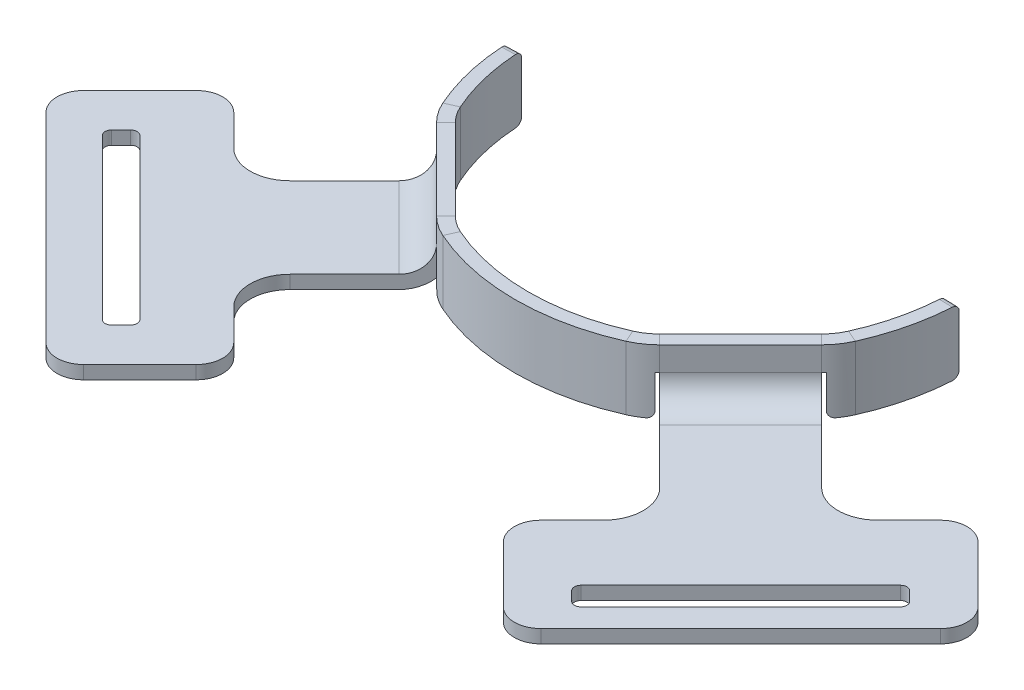
from build123d import *

# Parameters (mm, degrees)
BASE_FLANGE1_DEPTH             = 7.62
EDGE_FLANGE1_STRIP_W           = 12.7
EDGE_FLANGE1_STRIP_H           = 1.5875
EDGE_FLANGE1_STRIP_CUT_DEPTH   = 13.689174868
EDGE_FLANGE1_STRIP_2_W         = 12.7
EDGE_FLANGE1_STRIP_2_H         = 1.5875
EDGE_FLANGE1_STRIP_CUT_2_DEPTH = 13.689174868
EDGE_FLANGE1_DEPTH             = 13.689174868
EDGE_FLANGE1_BEND_DEPTH        = 13.689174868
SKETCH12_W                     = 0.396875
SKETCH12_H                     = 4.784490506
SKETCH12_H_2                   = 4.782978668
CUT_EXTRUDE3_DEPTH             = 25.4
SKETCH13_W                     = 0.396875
SKETCH13_H                     = 4.7625
CUT_EXTRUDE4_DEPTH             = 25.4
FILLET2_R                      = 0.79375
BOSS_EXTRUDE1_DEPTH            = 1.5875
FILLET3_R                      = 3.175
FILLET4_R                      = 4.7625
FILLET5_R                      = 0.79375


# Read off the part's stored shape, not the designer's step: Base-Flange1
# Sheet-metal steps are written as plain solids
with BuildPart() as part:
    # Base-Flange1 outline → Base-Flange1 (new body)
    with BuildSketch(Plane(origin=(0, 0, 0), x_dir=(1, 0, 0), z_dir=(0, 1, 0))):
        with BuildLine():
            ThreePointArc((24.665208878, -10.952288676), (26.30984284, -6.00976921), (26.974319291, -0.843359375))
            Line((26.974319291, -0.843359375), (25.387594627, -0.79375))
            ThreePointArc((25.387594627, -0.79375), (24.762205026, -5.656253374), (23.214314238, -10.308036401))
            ThreePointArc((23.214314238, -10.308036401), (22.645724221, -11.325105064), (21.900863739, -12.221155361))
            Line((21.900863739, -12.221155361), (12.221155361, -21.900863739))
            ThreePointArc((12.221155361, -21.900863739), (11.325105064, -22.645724221), (10.308036401, -23.214314238))
            ThreePointArc((10.308036401, -23.214314238), (0, -25.4), (-10.308036401, -23.214314238))
            ThreePointArc((-10.308036401, -23.214314238), (-11.325105064, -22.645724221), (-12.221155361, -21.900863739))
            Line((-12.221155361, -21.900863739), (-21.900863739, -12.221155361))
            ThreePointArc((-21.900863739, -12.221155361), (-22.645724221, -11.325105064), (-23.214314238, -10.308036401))
            ThreePointArc((-23.214314238, -10.308036401), (-24.762205026, -5.656253374), (-25.387594627, -0.79375))
            Line((-25.387594627, -0.79375), (-26.974319291, -0.843359375))
            ThreePointArc((-26.974319291, -0.843359375), (-26.30984284, -6.00976921), (-24.665208878, -10.952288676))
            ThreePointArc((-24.665208878, -10.952288676), (-23.954471356, -12.223624504), (-23.023395754, -13.343687376))
            Line((-23.023395754, -13.343687376), (-13.343687376, -23.023395754))
            ThreePointArc((-13.343687376, -23.023395754), (-12.223624504, -23.954471356), (-10.952288676, -24.665208878))
            ThreePointArc((-10.952288676, -24.665208878), (0, -26.9875), (10.952288676, -24.665208878))
            ThreePointArc((10.952288676, -24.665208878), (12.223624504, -23.954471356), (13.343687376, -23.023395754))
            Line((13.343687376, -23.023395754), (23.023395754, -13.343687376))
            ThreePointArc((23.023395754, -13.343687376), (23.954471356, -12.223624504), (24.665208878, -10.952288676))
        make_face()
    extrude(amount=BASE_FLANGE1_DEPTH)

    # Edge-Flange1 strip (across the edge) → Edge-Flange1 strip cut (cut)
    with BuildSketch(Plane(origin=(-23.023395754, 0, 13.343687376), x_dir=(0, 1, 0), z_dir=(0.7071067811865437, 0, 0.7071067811865515))):
        with Locations((-1.5875, -0.79375)):
            Rectangle(EDGE_FLANGE1_STRIP_W, EDGE_FLANGE1_STRIP_H)
    extrude(amount=EDGE_FLANGE1_STRIP_CUT_DEPTH, mode=Mode.SUBTRACT)

    # Edge-Flange1 strip 2 (across the edge) → Edge-Flange1 strip cut 2 (cut)
    with BuildSketch(Plane(origin=(13.343687376, 0, 23.023395754), x_dir=(0, 1, 0), z_dir=(0.7071067811865512, 0, -0.7071067811865438))):
        with Locations((-1.5875, -0.79375)):
            Rectangle(EDGE_FLANGE1_STRIP_2_W, EDGE_FLANGE1_STRIP_2_H)
    extrude(amount=EDGE_FLANGE1_STRIP_CUT_2_DEPTH, mode=Mode.SUBTRACT)

    # Edge-Flange1 section (across the edge) → Edge-Flange1 (add)
    with BuildSketch(Plane(origin=(-23.023395754, 0, 13.343687376), x_dir=(0, 1, 0), z_dir=(0.7071067811865437, 0, 0.7071067811865515))):
        with BuildLine():
            Line((0, 3.175), (0, 7.9375))
            Line((0, 7.9375), (1.5875, 7.9375))
            Line((1.5875, 7.9375), (1.5875, 3.175))
            ThreePointArc((1.5875, 3.175), (2.51743597, 0.92993597), (4.7625, 0))
            Line((4.7625, 0), (4.7625, -1.5875))
            ThreePointArc((4.7625, -1.5875), (1.394903955, -0.192596045), (0, 3.175))
        make_face()
    extrude(amount=EDGE_FLANGE1_DEPTH)

    # Edge-Flange1 section 2 (across the edge) → Edge-Flange1 bend (add)
    with BuildSketch(Plane(origin=(13.343687376, 0, 23.023395754), x_dir=(0, 1, 0), z_dir=(0.7071067811865512, 0, -0.7071067811865438))):
        with BuildLine():
            Line((0, 3.175), (0, 7.9375))
            Line((0, 7.9375), (1.5875, 7.9375))
            Line((1.5875, 7.9375), (1.5875, 3.175))
            ThreePointArc((1.5875, 3.175), (2.51743597, 0.92993597), (4.7625, 0))
            Line((4.7625, 0), (4.7625, -1.5875))
            ThreePointArc((4.7625, -1.5875), (1.394903955, -0.192596045), (0, 3.175))
        make_face()
    extrude(amount=EDGE_FLANGE1_BEND_DEPTH)

    # Sketch12 → Cut-Extrude3 (cut)
    with BuildSketch(Plane(origin=(-23.796201641, 0, 23.796201641), x_dir=(0.7071067811865438, 3.532708032038459e-15, 0.7071067811865512), z_dir=(-0.7071067811865512, -3.532708032038497e-15, 0.7071067811865438))):
        with Locations((7.043024934, 2.370254747)):
            Rectangle(SKETCH12_W, SKETCH12_H)
        with Locations((-7.043024934, 2.371010666)):
            Rectangle(SKETCH12_W, SKETCH12_H_2)
    extrude(amount=-CUT_EXTRUDE3_DEPTH, mode=Mode.SUBTRACT)

    # Sketch13 → Cut-Extrude4 (cut)
    with BuildSketch(Plane(origin=(23.796201641, 0, 23.796201641), x_dir=(0.7071067811865513, 3.414951097637176e-15, -0.7071067811865437), z_dir=(0.7071067811865437, -3.414951097637212e-15, 0.7071067811865513))):
        with Locations((7.043024934, 2.38125)):
            Rectangle(SKETCH13_W, SKETCH13_H)
        with Locations((-7.043024934, 2.38125)):
            Rectangle(SKETCH13_W, SKETCH13_H)
    extrude(amount=-CUT_EXTRUDE4_DEPTH, mode=Mode.SUBTRACT)

    # Fillet2
    fillet2_edges = [part.edges().sort_by_distance(p)[0] for p in [
        (-12.493889076, 0, 22.734863462),
        (-22.734863462, 0, 12.493889076),
        (-26.180956959, 0, 0.818554688),
        (22.734863462, 0, 12.493889076),
        (26.180956959, 0, 0.818554688),
        (12.493889076, 0, 22.734863462),
        (-26.180956959, 7.62, 0.818554688),
        (26.180956959, 7.62, 0.818554688),
    ]]
    fillet(fillet2_edges, radius=FILLET2_R)

    # Sketch4 → Boss-Extrude1 (add)
    # profile 1 of 2: a face of its own
    with BuildSketch(Plane(origin=(0, 1.5875, 0), x_dir=(1, 0, 0), z_dir=(0, 1, 0))):
        Polygon((-18.956347452, -28.63605583), (-25.46851022, -35.148218598), (-16.119559737, -44.49716908), (-27.344879889, -55.722489231), (-55.722489231, -27.344879889), (-44.49716908, -16.119559737), (-35.148218598, -25.46851022), (-28.63605583, -18.956347452), align=None)
        Polygon((-48.268876651, -28.063300378), (-28.063300378, -48.268876651), (-25.818236348, -46.02381262), (-46.02381262, -25.818236348), align=None, mode=Mode.SUBTRACT)
    # profile 2 of 2: a face of its own
    with BuildSketch(Plane(origin=(0, 1.5875, 0), x_dir=(1, 0, 0), z_dir=(0, 1, 0))):
        Polygon((18.956347452, -28.63605583), (25.46851022, -35.148218598), (16.119559737, -44.49716908), (27.344879889, -55.722489231), (55.722489231, -27.344879889), (44.49716908, -16.119559737), (35.148218598, -25.46851022), (28.63605583, -18.956347452), align=None)
        Polygon((29.185832393, -49.391408666), (26.940768363, -47.146344636), (47.146344636, -26.940768363), (49.391408666, -29.185832393), align=None, mode=Mode.SUBTRACT)
    extrude(amount=-BOSS_EXTRUDE1_DEPTH)

    # Fillet3
    fillet3_edges = [part.edges().sort_by_distance(p)[0] for p in [
        (-16.119559737, 0.79375, 44.49716908),
        (-27.344879889, 0.79375, 55.722489231),
        (-55.722489231, 0.79375, 27.344879889),
        (-44.49716908, 0.79375, 16.119559737),
        (44.49716908, 0.79375, 16.119559737),
        (55.722489231, 0.79375, 27.344879889),
        (27.344879889, 0.79375, 55.722489231),
        (16.119559737, 0.79375, 44.49716908),
    ]]
    fillet(fillet3_edges, radius=FILLET3_R)

    # Fillet4
    fillet4_edges = [part.edges().sort_by_distance(p)[0] for p in [
        (-25.46851022, 0.79375, 35.148218598),
        (-35.148218598, 0.79375, 25.46851022),
        (35.148218598, 0.79375, 25.46851022),
        (25.46851022, 0.79375, 35.148218598),
    ]]
    fillet(fillet4_edges, radius=FILLET4_R)

    # Fillet5
    fillet5_edges = [part.edges().sort_by_distance(p)[0] for p in [
        (-46.02381262, 0.79375, 25.818236348),
        (-25.818236348, 0.79375, 46.02381262),
        (-28.063300378, 0.79375, 48.268876651),
        (-48.268876651, 0.79375, 28.063300378),
        (29.185832393, 0.79375, 49.391408666),
        (26.940768363, 0.79375, 47.146344636),
        (47.146344636, 0.79375, 26.940768363),
        (49.391408666, 0.79375, 29.185832393),
    ]]
    fillet(fillet5_edges, radius=FILLET5_R)


solid = part.part
